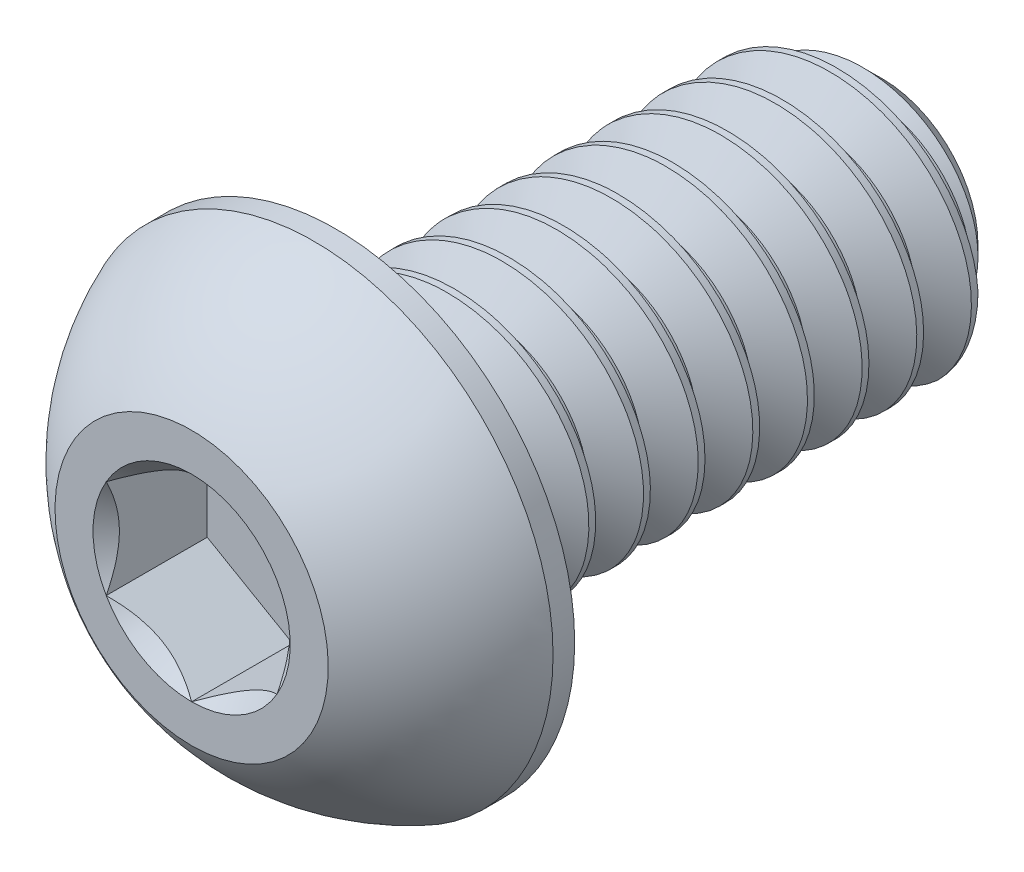
from build123d import *

# Parameters (mm, degrees)
SKETCH1_W          = 12.7
SKETCH1_H          = 3.175
CHAMFER1_SIZE      = 0.9525
CUT_SWEEP1_PITCH   = 1.27
CUT_EXTRUDE2_DEPTH = 2.34696


with BuildPart() as part:
    # Sketch1 → Revolve1 (revolve)
    with BuildSketch(Plane(origin=(0, 0, 0), x_dir=(0, 0, -1), z_dir=(1, 0, 0))):
        with Locations((9.7028, 1.5875)):
            Rectangle(SKETCH1_W, SKETCH1_H)
    revolve(axis=Axis((0, 0, -16.0528), (0, 0, 1)))

    # Chamfer1
    chamfer1_edges = [part.edges().sort_by_distance(p)[0] for p in [
        (0, -3.175, -16.0528),
    ]]
    chamfer(chamfer1_edges, length=CHAMFER1_SIZE)

    # Cut-Sweep1: the profile of Sketch2 profile screwed along a right-hand helix of 11 turns, 8 arcs to a turn; built about Z, then put on its axis
    cut_sweep1_z = Axis((0, 0, 0), (0, 0, 1))
    cut_sweep1_corners = [(3.1753, 0, 0.000173205), (3.1753, 0, -1.111423205), (2.350110803, 0, -0.635), (2.350110803, 0, -0.47625)]
    with BuildLine(mode=Mode.PRIVATE) as cut_sweep1_profile:
        Line(cut_sweep1_corners[0], cut_sweep1_corners[1])
        Line(cut_sweep1_corners[1], cut_sweep1_corners[2])
        Line(cut_sweep1_corners[2], cut_sweep1_corners[3])
        Line(cut_sweep1_corners[3], cut_sweep1_corners[0])
    cut_sweep1_cap = Face(cut_sweep1_profile.wire())
    cut_sweep1_turn_angles = [0, 22.5, 45, 67.5, 90, 112.5, 135, 157.5, 180, 202.5, 225, 247.5, 270, 292.5, 315, 337.5, 360]
    cut_sweep1_turn_weights = [1, 0.9238795325112867, 1, 0.9238795325112867, 1, 0.9238795325112867, 1, 0.9238795325112867, 1, 0.9238795325112867, 1, 0.9238795325112867, 1, 0.9238795325112867, 1, 0.9238795325112867, 1]
    cut_sweep1_turn_rails = [Edge.make_bspline([Vector(p[0], p[1], 0).rotate(cut_sweep1_z, cut_sweep1_turn_angles[k]) / cut_sweep1_turn_weights[k] + Vector(0, 0, p[2] + CUT_SWEEP1_PITCH * cut_sweep1_turn_angles[k] / 360) for k in range(17)], [0, 0, 0, 1, 1, 2, 2, 3, 3, 4, 4, 5, 5, 6, 6, 7, 7, 8, 8, 8], 2, cut_sweep1_turn_weights) for p in cut_sweep1_corners]
    cut_sweep1_turn_sides = [Face.make_surface_from_curves(cut_sweep1_turn_rails[p[0]], cut_sweep1_turn_rails[p[1]]) for p in [(0, 1), (1, 2), (2, 3), (3, 0)]]
    cut_sweep1 = Plane(origin=(0, 0, -16.0528), x_dir=(0, 1, 0), z_dir=(0, 0, 1)) * Solid(Shell([*[p.moved(Location((0, 0, CUT_SWEEP1_PITCH * i))) for i in range(11) for p in cut_sweep1_turn_sides], cut_sweep1_cap, cut_sweep1_cap.rotate(cut_sweep1_z, 3960).moved(Location((0, 0, CUT_SWEEP1_PITCH * 3960 / 360)))]))
    add(cut_sweep1, mode=Mode.SUBTRACT)

    # Sketch7 → Revolve2 (revolve)
    with BuildSketch(Plane(origin=(0, 0, 0), x_dir=(0, 0, -1), z_dir=(1, 0, 0)), mode=Mode.PRIVATE) as revolve2_sk:
        with BuildLine():
            Line((2.84988, 5.5499), (3.3528, 5.5499))
            Line((3.3528, 5.5499), (3.3528, 0))
            Line((3.3528, 0), (0, 0))
            Line((0, 0), (0, 3.175))
            ThreePointArc((0, 3.175), (1.235921075, 4.58927271), (2.84988, 5.5499))
        make_face()
    revolve(revolve2_sk.sketch.rotate(Axis((0, 0, 0), (0, 0, -1)), 189.052465708), axis=Axis((0, 0, 0), (0, 0, -1)))

    # Sketch5 → Cut-Extrude2 (cut)
    with BuildSketch(Plane.XY):
        Polygon((1.984375, -1.14567944), (1.984375, 1.14567944), (0, 2.291358881), (-1.984375, 1.14567944), (-1.984375, -1.14567944), (0, -2.291358881), align=None)
    extrude(amount=-CUT_EXTRUDE2_DEPTH, mode=Mode.SUBTRACT)

    # Cut-Extrude3 cone 1 section (through the dimple's axis) → Cut-Extrude3 (revolve, cut)
    with BuildSketch(Plane(origin=(0, 0, 0), x_dir=(0, -1, 0), z_dir=(1, 0, 0))):
        Polygon((0, 0), (2.291358881, 0), (0, 2.291358881), align=None)
    revolve(axis=Axis((0, 0, 0), (0, 0, -1)), mode=Mode.SUBTRACT)


solid = part.part
